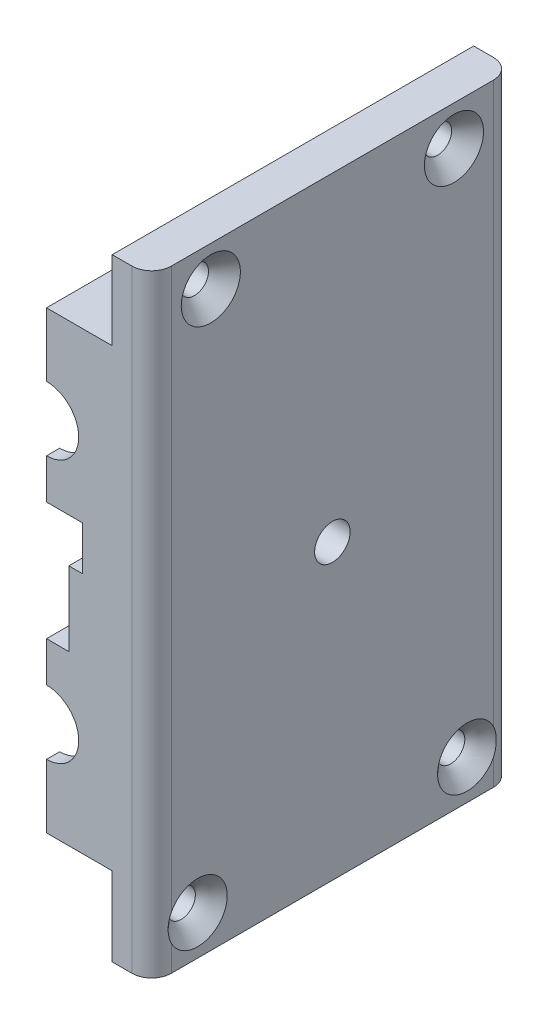
from build123d import *

# Parameters (mm, degrees)
BOSS_EXTRUDE1_DEPTH = 55
BOSS_EXTRUDE2_START = 2
BOSS_EXTRUDE2_DEPTH = 2
BOSS_EXTRUDE3_START = 2
BOSS_EXTRUDE3_DEPTH = 2
BOSS_EXTRUDE5_START = 2
BOSS_EXTRUDE5_DEPTH = 2
BOSS_EXTRUDE6_DEPTH = 2
SKETCH7_W           = 3.4
SKETCH7_H           = 11.3
CUT_EXTRUDE2_DEPTH  = 55
SKETCH8_R           = 2.15
CUT_EXTRUDE3_DEPTH  = 6
SKETCH9_R           = 2.7
CUT_EXTRUDE4_DEPTH  = 12.6
LPATTERN1_COUNT     = 2
LPATTERN1_PITCH     = 37
LPATTERN2_COUNT     = 2
LPATTERN2_PITCH     = 41
FILLET1_R           = 3


with BuildPart() as part:
    # Sketch1 → Boss-Extrude1 (new body)
    with BuildSketch(Plane.XY):
        with BuildLine():
            Line((0, 0), (0, -93.2))
            Line((0, -93.2), (-6, -93.2))
            Line((-6, -93.2), (-6, -81.2))
            Line((-6, -81.2), (-16, -81.2))
            Line((-16, -81.2), (-16, -74.2))
            ThreePointArc((-16, -74.2), (-8.4, -66.6), (-16, -59))
            Line((-16, -59), (-16, -44.3))
            Line((-16, -44.3), (-10.5, -44.3))
            Line((-10.5, -44.3), (-10.5, -37.6))
            Line((-10.5, -37.6), (-16, -37.6))
            Line((-16, -37.6), (-16, -34.2))
            ThreePointArc((-16, -34.2), (-8.4, -26.6), (-16, -19))
            Line((-16, -19), (-16, -12))
            Line((-16, -12), (-6, -12))
            Line((-6, -12), (-6, 0))
            Line((-6, 0), (0, 0))
        make_face()
    extrude(amount=BOSS_EXTRUDE1_DEPTH)

    # Sketch2 → Boss-Extrude2 (add)
    with BuildSketch(Plane(origin=(0, 0, 28.5), x_dir=(-1, 0, 0), z_dir=(0, 0, -1)).offset(BOSS_EXTRUDE2_START)):
        with BuildLine():
            Line((16, -34.2), (16, -31.5))
            ThreePointArc((16, -31.5), (11.1, -26.6), (16, -21.7))
            Line((16, -21.7), (16, -19))
            ThreePointArc((16, -19), (8.4, -26.6), (16, -34.2))
        make_face()
    extrude(amount=-BOSS_EXTRUDE2_DEPTH)

    # Sketch3 → Boss-Extrude3 (add)
    with BuildSketch(Plane(origin=(0, 0, 28.5), x_dir=(-1, 0, 0), z_dir=(0, 0, -1)).offset(BOSS_EXTRUDE3_START)):
        with BuildLine():
            Line((16, -74.2), (16, -71.5))
            ThreePointArc((16, -71.5), (11.1, -66.6), (16, -61.7))
            Line((16, -61.7), (16, -59))
            ThreePointArc((16, -59), (8.4, -66.6), (16, -74.2))
        make_face()
    extrude(amount=-BOSS_EXTRUDE3_DEPTH)

    # Sketch4 → Boss-Extrude5 (add)
    with BuildSketch(Plane(origin=(0, 0, 2), x_dir=(-1, 0, 0), z_dir=(0, 0, -1)).offset(BOSS_EXTRUDE5_START)):
        with BuildLine():
            Line((16, -59), (16, -61.7))
            ThreePointArc((16, -61.7), (11.1, -66.6), (16, -71.5))
            Line((16, -71.5), (16, -74.2))
            ThreePointArc((16, -74.2), (8.4, -66.6), (16, -59))
        make_face()
        with BuildLine():
            Line((16, -19), (16, -21.7))
            ThreePointArc((16, -21.7), (11.1, -26.6), (16, -31.5))
            Line((16, -31.5), (16, -34.2))
            ThreePointArc((16, -34.2), (8.4, -26.6), (16, -19))
        make_face()
    extrude(amount=-BOSS_EXTRUDE5_DEPTH)

    # Sketch5 → Boss-Extrude6 (add)
    with BuildSketch(Plane(origin=(0, 0, 53), x_dir=(-1, 0, 0), z_dir=(0, 0, -1))):
        with BuildLine():
            Line((16, -19), (16, -21.7))
            ThreePointArc((16, -21.7), (11.1, -26.6), (16, -31.5))
            Line((16, -31.5), (16, -34.2))
            ThreePointArc((16, -34.2), (8.4, -26.6), (16, -19))
        make_face()
        with BuildLine():
            Line((16, -59), (16, -61.7))
            ThreePointArc((16, -61.7), (11.1, -66.6), (16, -71.5))
            Line((16, -71.5), (16, -74.2))
            ThreePointArc((16, -74.2), (8.4, -66.6), (16, -59))
        make_face()
    extrude(amount=-BOSS_EXTRUDE6_DEPTH)

    # Sketch7 → Cut-Extrude2 (cut)
    with BuildSketch(Plane.XY.offset(55)):
        with Locations((-14.3, -49.95)):
            Rectangle(SKETCH7_W, SKETCH7_H)
    extrude(amount=-CUT_EXTRUDE2_DEPTH, mode=Mode.SUBTRACT)

    # Sketch8 → Cut-Extrude3 (cut)
    with BuildSketch(Plane(origin=(0, 0, 0), x_dir=(0, 0, -1), z_dir=(1, 0, 0))):
        with Locations(Location((-46, -6, 0), (0, 0, 90))):
            Circle(SKETCH8_R)
        with Locations(Location((-9, -6, 0), (0, 0, 90))):
            Circle(SKETCH8_R)
        with Locations(Location((-7, -87.2, 0), (0, 0, 90))):
            Circle(SKETCH8_R)
        with Locations(Location((-48, -87.2, 0), (0, 0, 90))):
            Circle(SKETCH8_R)
    extrude(amount=-CUT_EXTRUDE3_DEPTH, mode=Mode.SUBTRACT)

    # Sketch9 → Cut-Extrude4 (cut)
    with BuildSketch(Plane(origin=(0, 0, 0), x_dir=(0, 0, -1), z_dir=(1, 0, 0))):
        with Locations(Location((-27.5, -48.6, 0), (0, 0, 90))):
            Circle(SKETCH9_R)
    extrude(amount=-CUT_EXTRUDE4_DEPTH, mode=Mode.SUBTRACT)

    # Cut-Loft1: read off the stored shape, not the designer's step
    # Cut-Loft1: loft between two sections, ruled curve by curve
    cut_loft1_from = [
        Edge.make_bspline([(0, -9.090752309, 49.270665095), (0, -2.54942212, 55.452169714), (0, 3.632082499, 48.910839524), (0, -2.909247691, 42.729334905), (0, -9.45057788, 36.547830286), (0, -15.632082499, 43.089160476), (0, -9.090752309, 49.270665095)], [0, 0, 0, 0, 0.5, 0.5, 0.5, 1, 1, 1, 1], 3, [1, 0.333333333, 0.333333333, 1, 0.333333333, 0.333333333, 1]),
    ]
    cut_loft1_to = [
        Edge.make_bspline([(-2.5, -7.797727139, 47.179269746), (-2.5, -5.439187646, 50.774724024), (-2.5, -1.843733369, 48.416184531), (-2.5, -4.202272861, 44.820730254), (-2.5, -6.560812354, 41.225275976), (-2.5, -10.156266631, 43.583815469), (-2.5, -7.797727139, 47.179269746)], [0, 0, 0, 0, 0.5, 0.5, 0.5, 1, 1, 1, 1], 3, [1, 0.333333333, 0.333333333, 1, 0.333333333, 0.333333333, 1]),
    ]
    cut_loft1 = Solid(Shell([*[Face.make_surface_from_curves(cut_loft1_from[k], cut_loft1_to[k]) for k in range(1)], Face(Wire(cut_loft1_from)), Face(Wire(cut_loft1_to))]))
    add(cut_loft1, mode=Mode.SUBTRACT)

    # LPattern1: Cut-Loft1 ×2
    with Locations(*[(0, 0, -i * LPATTERN1_PITCH) for i in range(1, LPATTERN1_COUNT)]):
        add(cut_loft1, mode=Mode.SUBTRACT)

    # Cut-Loft2: read off the stored shape, not the designer's step
    # Cut-Loft2: loft between two sections, ruled curve by curve
    cut_loft2_from = [
        Edge.make_bspline([(-2.5, -88.803773463, 46.568074485), (-2.5, -85.939922433, 43.36052756), (-2.5, -82.732375507, 46.22437859), (-2.5, -85.596226537, 49.431925515), (-2.5, -88.460077567, 52.63947244), (-2.5, -91.667624493, 49.77562141), (-2.5, -88.803773463, 46.568074485)], [0, 0, 0, 0, 0.5, 0.5, 0.5, 1, 1, 1, 1], 3, [1, 0.333333333, 0.333333333, 1, 0.333333333, 0.333333333, 1]),
    ]
    cut_loft2_to = [
        Edge.make_bspline([(0, -88.245004687, 43.623018711), (0, -79.491042109, 41.533009337), (0, -77.401032735, 50.286971915), (0, -86.154995313, 52.376981289), (0, -94.908957891, 54.466990663), (0, -96.998967265, 45.713028085), (0, -88.245004687, 43.623018711)], [0, 0, 0, 0, 0.5, 0.5, 0.5, 1, 1, 1, 1], 3, [1, 0.333333333, 0.333333333, 1, 0.333333333, 0.333333333, 1]),
    ]
    cut_loft2 = Solid(Shell([*[Face.make_surface_from_curves(cut_loft2_from[k], cut_loft2_to[k]) for k in range(1)], Face(Wire(cut_loft2_from)), Face(Wire(cut_loft2_to))]))
    add(cut_loft2, mode=Mode.SUBTRACT)

    # LPattern2: Cut-Loft2 ×2
    with Locations(*[(0, 0, -i * LPATTERN2_PITCH) for i in range(1, LPATTERN2_COUNT)]):
        add(cut_loft2, mode=Mode.SUBTRACT)

    # Fillet1
    # the kernel refuses this fillet: 3 mm, written as the material it takes off along each edge
    with BuildSketch(Plane(origin=(0, 7.5, 0), x_dir=(-1, 0, 0), z_dir=(0, -1, 0))) as fillet1_piece_1:
        with BuildLine():
            CenterArc((FILLET1_R, -FILLET1_R), FILLET1_R, 90, 90)
            Line((0, -FILLET1_R), (0, 0))
            Line((0, 0), (FILLET1_R, 0))
        make_face()
    extrude(amount=108.2, mode=Mode.SUBTRACT)
    with BuildSketch(Plane(origin=(0, 7.5, 55), x_dir=(-1, 0, 0), z_dir=(0, -1, 0))) as fillet1_piece_2:
        with BuildLine():
            CenterArc((FILLET1_R, FILLET1_R), FILLET1_R, 180, 90)
            Line((0, FILLET1_R), (0, 0))
            Line((0, 0), (FILLET1_R, 0))
        make_face()
    extrude(amount=108.2, mode=Mode.SUBTRACT)


solid = part.part
